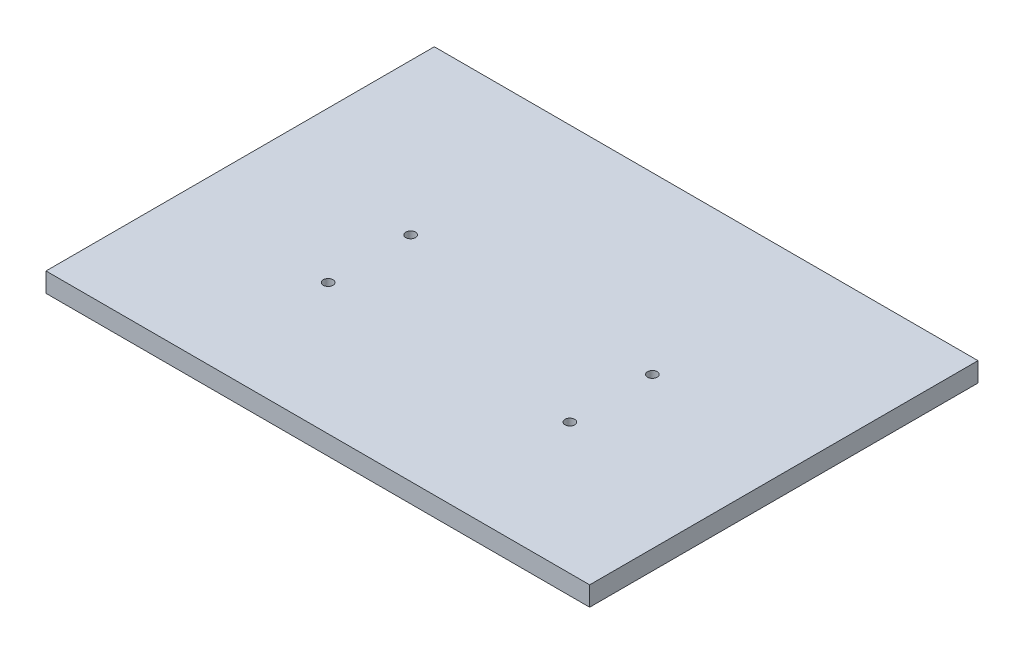
from build123d import *

# Parameters (mm, degrees)
SKETCH1_W           = 711.2
SKETCH1_H           = 508
BOSS_EXTRUDE1_DEPTH = 25.4
SKETCH3_R           = 6.35
CUT_EXTRUDE1_DEPTH  = 662.612368604


with BuildPart() as part:
    # Sketch1 → Boss-Extrude1 (new body)
    with BuildSketch(Plane(origin=(0, 0, 0), x_dir=(1, 0, 0), z_dir=(0, 1, 0))):
        with Locations((179.878427205, -133.748140276)):
            Rectangle(SKETCH1_W, SKETCH1_H)
    extrude(amount=BOSS_EXTRUDE1_DEPTH)

    # Sketch3 → Cut-Extrude1 (cut, through all)
    with BuildSketch(Plane(origin=(0, 25.4, 0), x_dir=(1, 0, 0), z_dir=(0, 1, 0))):
        with Locations((21.890427205, -216.298140276)):
            Circle(SKETCH3_R)
        with Locations((21.890427205, -108.348140276)):
            Circle(SKETCH3_R)
        with Locations((338.120427205, -108.348140276)):
            Circle(SKETCH3_R)
        with Locations((338.120427205, -216.298140276)):
            Circle(SKETCH3_R)
    extrude(amount=-CUT_EXTRUDE1_DEPTH, mode=Mode.SUBTRACT)


solid = part.part
